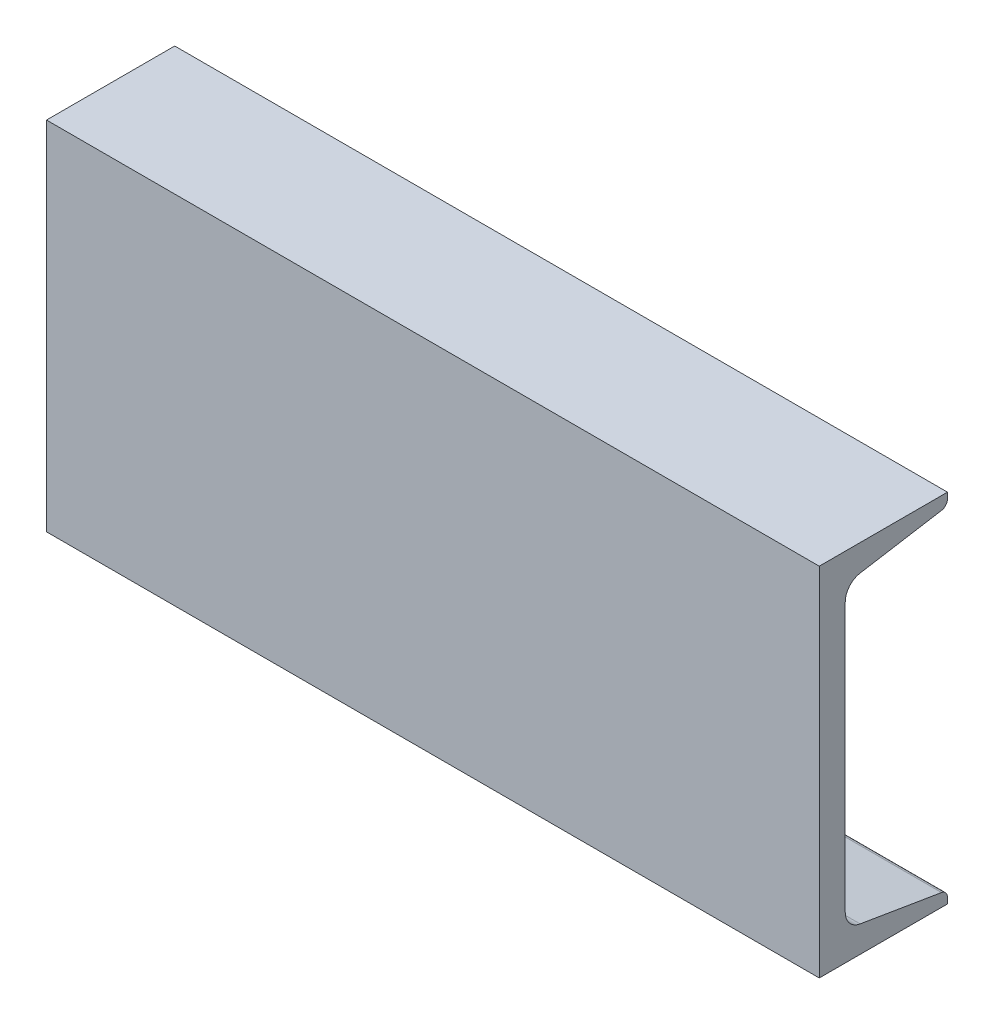
from build123d import *

# Parameters (mm, degrees)
BOSS_EXTRUDE1_DEPTH = 165.1


with BuildPart() as part:
    # Sketch1 → Boss-Extrude1 (new, symmetric)
    with BuildSketch(Plane(origin=(0, 0, 0), x_dir=(0, 0, -1), z_dir=(1, 0, 0))):
        with BuildLine():
            Line((-27.3939, -76.2), (-27.3939, 76.2))
            Line((-27.3939, 76.2), (27.3939, 76.2))
            Line((27.3939, 76.2), (27.3939, 73.710744653))
            ThreePointArc((27.3939, 73.710744653), (26.67159656, 71.740607726), (24.84702368, 70.704221901))
            Line((24.84702368, 70.704221901), (-9.926909199, 64.908143628))
            ThreePointArc((-9.926909199, 64.908143628), (-14.488341399, 62.317179067), (-16.2941, 57.391836749))
            Line((-16.2941, 57.391836749), (-16.2941, -57.391836749))
            ThreePointArc((-16.2941, -57.391836749), (-14.488341399, -62.317179067), (-9.926909199, -64.908143628))
            Line((-9.926909199, -64.908143628), (24.84702368, -70.704221901))
            ThreePointArc((24.84702368, -70.704221901), (26.67159656, -71.740607726), (27.3939, -73.710744653))
            Line((27.3939, -73.710744653), (27.3939, -76.2))
            Line((27.3939, -76.2), (-27.3939, -76.2))
        make_face()
    extrude(amount=BOSS_EXTRUDE1_DEPTH, both=True)


solid = part.part
